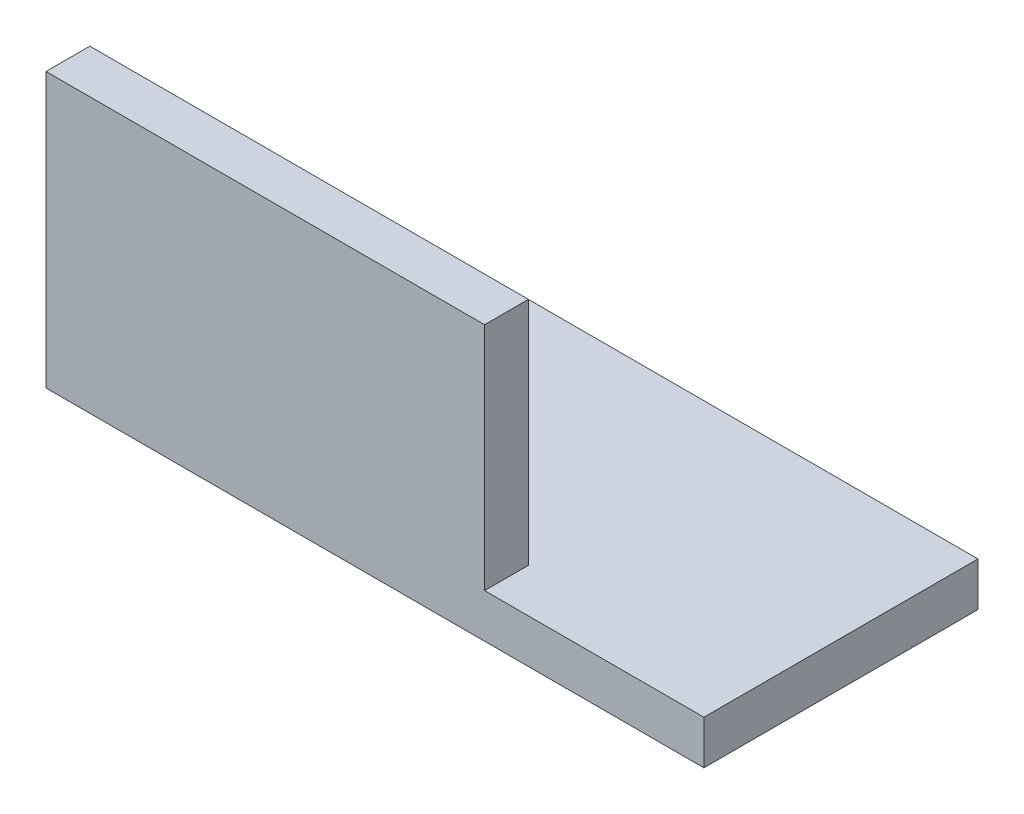
from build123d import *

# Parameters (mm, degrees)
EXTRUDE_1_DEPTH     = 60
SKETCH_2_W          = 20
SKETCH_2_H          = 21
CUT_EXTRUDE_1_DEPTH = 70.641941386


with BuildPart() as part:
    # Эскиз1 → Вытянуть-Тонкостенный1 (new body)
    with BuildSketch(Plane(origin=(0, 0, 0), x_dir=(0, 0, -1), z_dir=(1, 0, 0))):
        Polygon((0, 25), (0, 0), (25, 0), (25, 4), (4, 4), (4, 25), align=None)
    extrude(amount=EXTRUDE_1_DEPTH)

    # Эскиз2 → Вырез-Вытянуть1 (cut, through all)
    with BuildSketch(Plane.XY):
        with Locations((50, 14.5)):
            Rectangle(SKETCH_2_W, SKETCH_2_H)
    extrude(amount=-CUT_EXTRUDE_1_DEPTH, mode=Mode.SUBTRACT)


solid = part.part
